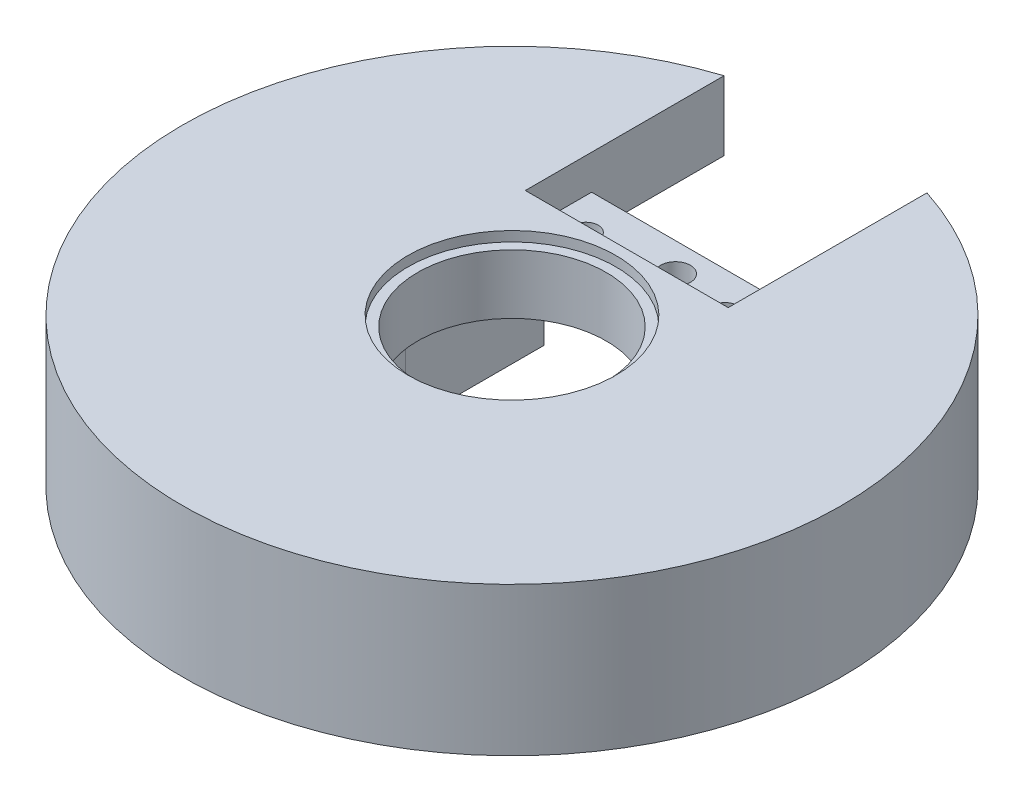
from build123d import *

# Parameters (mm, degrees)
SKETCH1_R           = 33.3
BOSS_EXTRUDE1_DEPTH = 15
CIRPATTERN1_COUNT   = 3
CUT_EXTRUDE1_DEPTH  = 8
CUT_EXTRUDE3_REACH  = 51.424
SKETCH6_R           = 9.525
SKETCH6_4_R         = 10.5
SKETCH6_4_R_2       = 9.525
CUT_EXTRUDE4_DEPTH  = 1
SKETCH7_R           = 1.25
SKETCH7_R_2         = 1.5
CUT_EXTRUDE5_DEPTH  = 50.424487858
SKETCH8_W           = 20.5
SKETCH8_H           = 25
CUT_EXTRUDE6_DEPTH  = 3.5
CUT_EXTRUDE7_REACH  = 50.477
SKETCH9_W           = 20.5
SKETCH9_H           = 20


with BuildPart() as part:
    # Sketch1 → Boss-Extrude1 (new body)
    with BuildSketch(Plane(origin=(0, 0, 0), x_dir=(1, 0, 0), z_dir=(0, 1, 0))):
        Circle(SKETCH1_R)
    extrude(amount=BOSS_EXTRUDE1_DEPTH)

    # Sketch3 → Cut-Revolve7 (revolve, cut)
    with BuildSketch(Plane.XZ):
        with BuildLine():
            Line((2.5019, 18), (-2.5019, 18))
            ThreePointArc((-2.5019, 18), (0, 15.4981), (2.5019, 18))
        make_face()
    cut_revolve7 = revolve(axis=Axis((3.292813159, 0, 18), (-1, 0, 0)), mode=Mode.SUBTRACT)

    # CirPattern1: Cut-Revolve7 ×3 about axis
    cirpattern1_axis = Axis((0, 0, 0), (0, 1, 0))
    for i in range(1, CIRPATTERN1_COUNT):
        add(cut_revolve7.rotate(cirpattern1_axis, i * 360 / CIRPATTERN1_COUNT), mode=Mode.SUBTRACT)

    # Sketch5 → Cut-Extrude1 (cut)
    with BuildSketch(Plane.XZ):
        with BuildLine():
            Line((10.75, -14), (10.75, 0))
            ThreePointArc((10.75, 0), (0, 10.75), (-10.75, 0))
            Line((-10.75, 0), (-10.75, -14))
            Line((-10.75, -14), (-21.865516704, -25.115516704))
            ThreePointArc((-21.865516704, -25.115516704), (0, -33.3), (21.865516704, -25.115516704))
            Line((21.865516704, -25.115516704), (10.75, -14))
        make_face()
    extrude(amount=-CUT_EXTRUDE1_DEPTH, mode=Mode.SUBTRACT)

    # Sketch6 → Cut-Extrude3 (cut, up to next)
    with BuildSketch(Plane(origin=(0, 15, 0), x_dir=(1, 0, 0), z_dir=(0, 1, 0)), mode=Mode.PRIVATE) as cut_extrude3_sk1:
        Circle(SKETCH6_R)
    cut_extrude3_tool1 = extrude(cut_extrude3_sk1.sketch, amount=-CUT_EXTRUDE3_REACH, mode=Mode.PRIVATE) & part.part
    add(cut_extrude3_tool1.solids().sort_by_distance((0, 15, 0))[0], mode=Mode.SUBTRACT)

    # Sketch6<4> → Cut-Extrude4 (cut)
    with BuildSketch(Plane(origin=(0, 15, 0), x_dir=(1, 0, 0), z_dir=(0, 1, 0))):
        Circle(SKETCH6_4_R)
        Circle(SKETCH6_4_R_2, mode=Mode.SUBTRACT)
    extrude(amount=-CUT_EXTRUDE4_DEPTH, mode=Mode.SUBTRACT)

    # Sketch7 → Cut-Extrude5 (cut, through all)
    with BuildSketch(Plane(origin=(0, 15, 0), x_dir=(1, 0, 0), z_dir=(0, 1, 0))):
        with Locations((-7.03, 14.5)):
            Circle(SKETCH7_R)
        with Locations((7.03, 14.5)):
            Circle(SKETCH7_R)
        with Locations((1.13, 15.4)):
            Circle(SKETCH7_R_2)
    extrude(amount=-CUT_EXTRUDE5_DEPTH, mode=Mode.SUBTRACT)

    # Sketch8 → Cut-Extrude6 (cut)
    with BuildSketch(Plane(origin=(0, 15, 0), x_dir=(1, 0, 0), z_dir=(0, 1, 0))):
        with Locations((0, 24.1)):
            Rectangle(SKETCH8_W, SKETCH8_H)
    extrude(amount=-CUT_EXTRUDE6_DEPTH, mode=Mode.SUBTRACT)

    # Sketch9 → Cut-Extrude7 (cut, up to next)
    with BuildSketch(Plane(origin=(0, 11.5, 0), x_dir=(1, 0, 0), z_dir=(0, 1, 0)), mode=Mode.PRIVATE) as cut_extrude7_sk1:
        with Locations((0, 28.3)):
            Rectangle(SKETCH9_W, SKETCH9_H)
    cut_extrude7_tool1 = extrude(cut_extrude7_sk1.sketch, amount=-CUT_EXTRUDE7_REACH, mode=Mode.PRIVATE) & part.part
    add(cut_extrude7_tool1.solids().sort_by_distance((0, 11.5, -28.3))[0], mode=Mode.SUBTRACT)


solid = part.part
